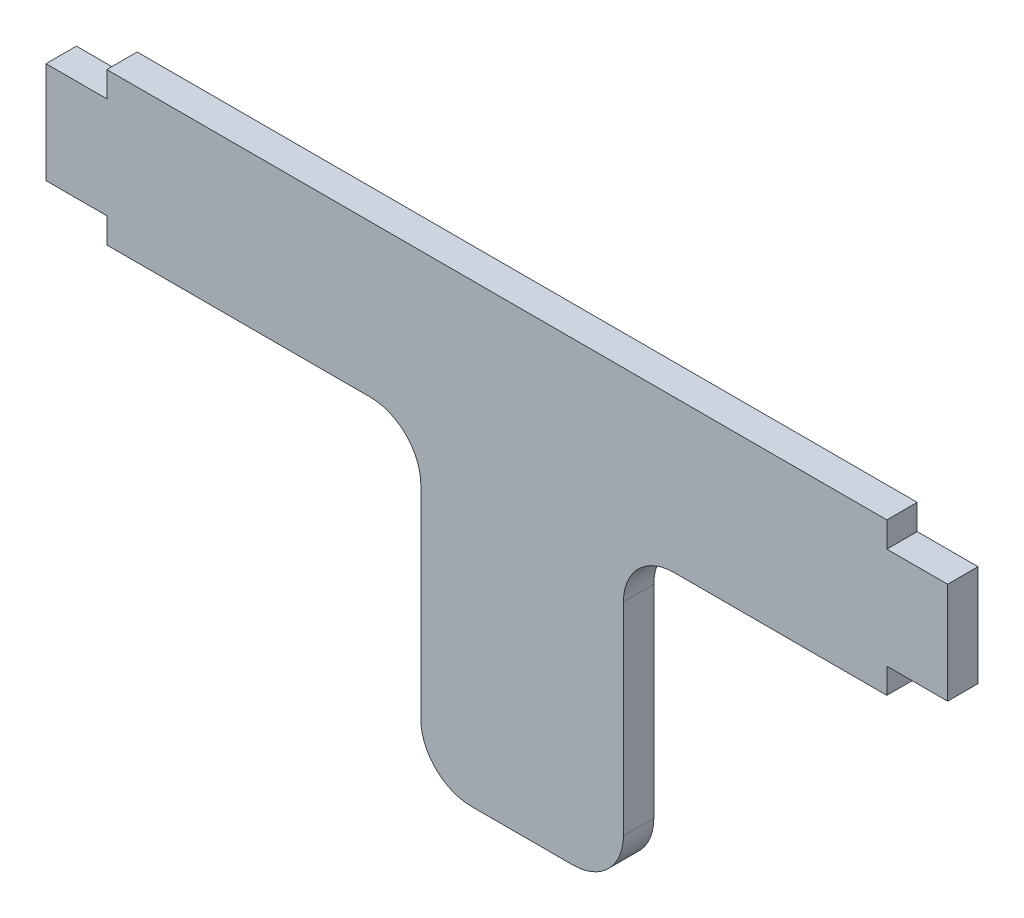
from build123d import *

# Parameters (mm, degrees)
RESSALTO_EXTRUS_O1_DEPTH = 3
FILETE1_R                = 5


with BuildPart() as part:
    # Esboço1 → Ressalto-extrusão1 (new body)
    with BuildSketch(Plane.XY):
        Polygon((12.5, -7.5), (38.5, -7.5), (38.5, -5), (44.5, -5), (44.5, 5), (38.5, 5), (38.5, 7.5), (-38.5, 7.5), (-38.5, 5), (-44.5, 5), (-44.5, -5), (-38.5, -5), (-38.5, -7.5), (-7.5, -7.5), (-7.5, -37.5), (12.5, -37.5), align=None)
    extrude(amount=RESSALTO_EXTRUS_O1_DEPTH)

    # Filete1
    filete1_edges = [part.edges().sort_by_distance(p)[0] for p in [
        (12.5, -37.5, 1.5),
        (-7.5, -37.5, 1.5),
        (-7.5, -7.5, 1.5),
        (12.5, -7.5, 1.5),
    ]]
    fillet(filete1_edges, radius=FILETE1_R)


solid = part.part
